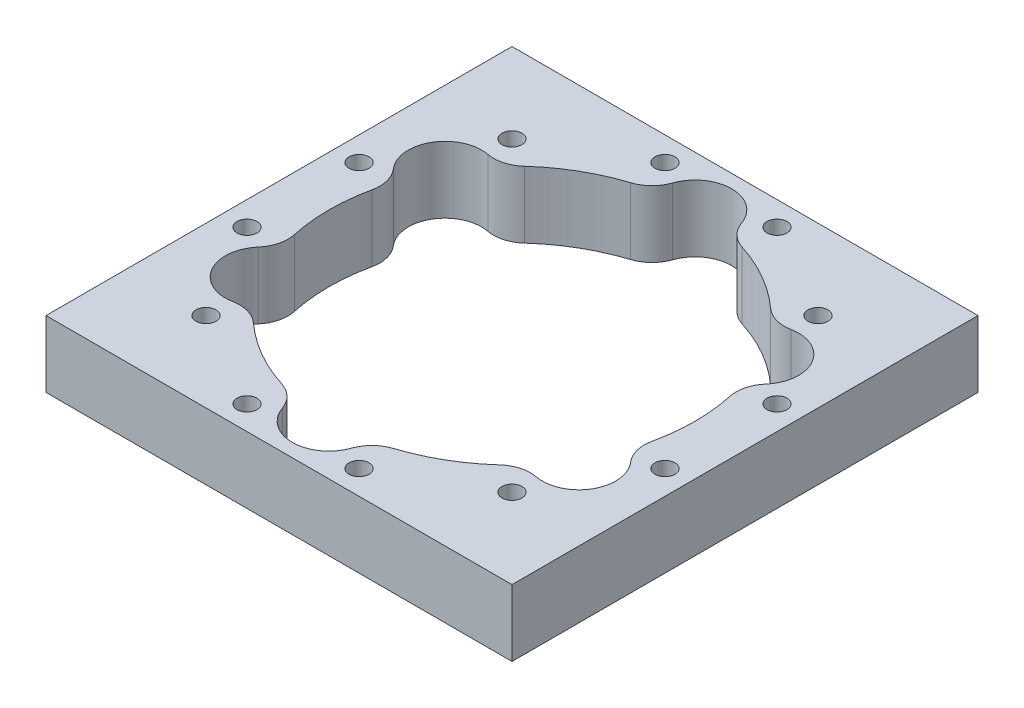
from build123d import *

# Parameters (mm, degrees)
SKETCH1_W           = 70
SKETCH1_H           = 70
SKETCH1_R           = 1.5
BOSS_EXTRUDE1_DEPTH = 10
FILLET1_R           = 5


with BuildPart() as part:
    # Sketch1 → Boss-Extrude1 (new body)
    with BuildSketch(Plane(origin=(0, 0, 0), x_dir=(1, 0, 0), z_dir=(0, 1, 0))):
        Rectangle(SKETCH1_W, SKETCH1_H)
        with Locations((-22.980970389, -22.980970389)):
            Circle(SKETCH1_R, mode=Mode.SUBTRACT)
        with Locations((-8.411618966, -31.392589354)):
            Circle(SKETCH1_R, mode=Mode.SUBTRACT)
        with Locations((-31.392589354, -8.411618966)):
            Circle(SKETCH1_R, mode=Mode.SUBTRACT)
        with Locations((8.411618966, -31.392589354)):
            Circle(SKETCH1_R, mode=Mode.SUBTRACT)
        with Locations((22.980970389, -22.980970389)):
            Circle(SKETCH1_R, mode=Mode.SUBTRACT)
        with Locations((31.392589354, -8.411618966)):
            Circle(SKETCH1_R, mode=Mode.SUBTRACT)
        with Locations((-31.392589354, 8.411618966)):
            Circle(SKETCH1_R, mode=Mode.SUBTRACT)
        with Locations((-22.980970389, 22.980970389)):
            Circle(SKETCH1_R, mode=Mode.SUBTRACT)
        with Locations((-8.411618966, 31.392589354)):
            Circle(SKETCH1_R, mode=Mode.SUBTRACT)
        with BuildLine():
            ThreePointArc((26.075600084, 8.735735817), (27.141564088, 4.425550683), (27.5, 0))
            ThreePointArc((27.5, 0), (27.141564088, -4.425550683), (26.075600084, -8.735735817))
            ThreePointArc((26.075600084, -8.735735817), (28.435193064, -10.764992307), (29.315698604, -13.75))
            ThreePointArc((29.315698604, -13.75), (26.323794313, -18.644839723), (20.60316918, -18.214264183))
            ThreePointArc((20.60316918, -18.214264183), (13.75, -23.815698604), (5.472430904, -26.95))
            ThreePointArc((5.472430904, -26.95), (5.493103402, -27.224654737), (5.5, -27.5))
            ThreePointArc((5.5, -27.5), (-0.275345263, -32.993103402), (-5.472430904, -26.95))
            ThreePointArc((-5.472430904, -26.95), (-13.75, -23.815698604), (-20.60316918, -18.214264183))
            ThreePointArc((-20.60316918, -18.214264183), (-28.578838325, -16.5), (-26.075600084, -8.735735817))
            ThreePointArc((-26.075600084, -8.735735817), (-27.5, 0), (-26.075600084, 8.735735817))
            ThreePointArc((-26.075600084, 8.735735817), (-28.578838325, 16.5), (-20.60316918, 18.214264183))
            ThreePointArc((-20.60316918, 18.214264183), (-13.75, 23.815698604), (-5.472430904, 26.95))
            ThreePointArc((-5.472430904, 26.95), (-0.275345263, 32.993103402), (5.5, 27.5))
            ThreePointArc((5.5, 27.5), (5.493103402, 27.224654737), (5.472430904, 26.95))
            ThreePointArc((5.472430904, 26.95), (13.75, 23.815698604), (20.60316918, 18.214264183))
            ThreePointArc((20.60316918, 18.214264183), (26.323794313, 18.644839723), (29.315698604, 13.75))
            ThreePointArc((29.315698604, 13.75), (28.435193064, 10.764992307), (26.075600084, 8.735735817))
        make_face(mode=Mode.SUBTRACT)
        with Locations((31.392589354, 8.411618966)):
            Circle(SKETCH1_R, mode=Mode.SUBTRACT)
        with Locations((8.411618966, 31.392589354)):
            Circle(SKETCH1_R, mode=Mode.SUBTRACT)
        with Locations((22.980970389, 22.980970389)):
            Circle(SKETCH1_R, mode=Mode.SUBTRACT)
    extrude(amount=BOSS_EXTRUDE1_DEPTH)

    # Fillet1
    fillet1_edges = [part.edges().sort_by_distance(p)[0] for p in [
        (5.472430904, 5, -26.95),
        (20.60316918, 5, -18.214264183),
        (26.075600084, 5, 8.735735817),
        (26.075600084, 5, -8.735735817),
        (20.60316918, 5, 18.214264183),
        (5.472430904, 5, 26.95),
        (-5.472430904, 5, 26.95),
        (-20.60316918, 5, 18.214264183),
        (-26.075600084, 5, 8.735735817),
        (-26.075600084, 5, -8.735735817),
        (-20.60316918, 5, -18.214264183),
        (-5.472430904, 5, -26.95),
    ]]
    fillet(fillet1_edges, radius=FILLET1_R)


solid = part.part
